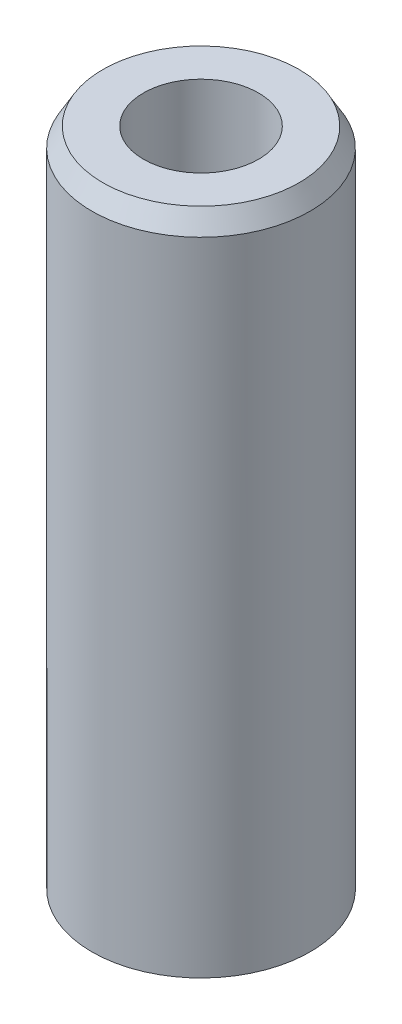
from build123d import *
from OCP.BRepFilletAPI import BRepFilletAPI_MakeChamfer

# Parameters (mm, degrees)
SKETCH1_R           = 17.5
BOSS_EXTRUDE1_DEPTH = 107.656707819
SKETCH2_R           = 9.22076036
CUT_EXTRUDE1_DEPTH  = 111.464776008
CHAMFER1_SIZE       = 3.062892759
CHAMFER1_SIZE2      = 1.768361959


with BuildPart() as part:
    # Sketch1 → Boss-Extrude1 (new body)
    with BuildSketch(Plane(origin=(0, 0, 0), x_dir=(1, 0, 0), z_dir=(0, 1, 0))):
        Circle(SKETCH1_R)
    extrude(amount=BOSS_EXTRUDE1_DEPTH)

    # Sketch2 → Cut-Extrude1 (cut, through all)
    with BuildSketch(Plane(origin=(0, 0, 0), x_dir=(1, 0, 0), z_dir=(0, 1, 0))):
        Circle(SKETCH2_R)
    extrude(amount=CUT_EXTRUDE1_DEPTH, mode=Mode.SUBTRACT)

    # Chamfer1: one chamfer whose edges measure the first distance from different faces: ONE call of the kernel's chamfer builder (chamfer() names one face for all edges)
    chamfer1_edges_1 = [part.edges().sort_by_distance(p)[0] for p in [
        (-17.5, 107.656707819, 0),
    ]]
    chamfer1_side_1 = [part.faces().sort_by_distance(p)[0] for p in [
        (-17.5, 53.82835391, 0),
    ]]
    chamfer1_edges_2 = [part.edges().sort_by_distance(p)[0] for p in [
        (-17.5, 0, 0),
    ]]
    chamfer1_side_2 = [part.faces().sort_by_distance(p)[0] for p in [
        (-17.005025253, 0, 0),
    ]]
    chamfer1 = BRepFilletAPI_MakeChamfer(part.part.solid().wrapped)
    for e in chamfer1_edges_1:
        chamfer1.Add(CHAMFER1_SIZE, CHAMFER1_SIZE2, e.wrapped, chamfer1_side_1[0].wrapped)  # the first distance lies on this face
    for e in chamfer1_edges_2:
        chamfer1.Add(CHAMFER1_SIZE, CHAMFER1_SIZE2, e.wrapped, chamfer1_side_2[0].wrapped)  # the first distance lies on this face
    add(Compound.cast(chamfer1.Shape()), mode=Mode.REPLACE)


solid = part.part
